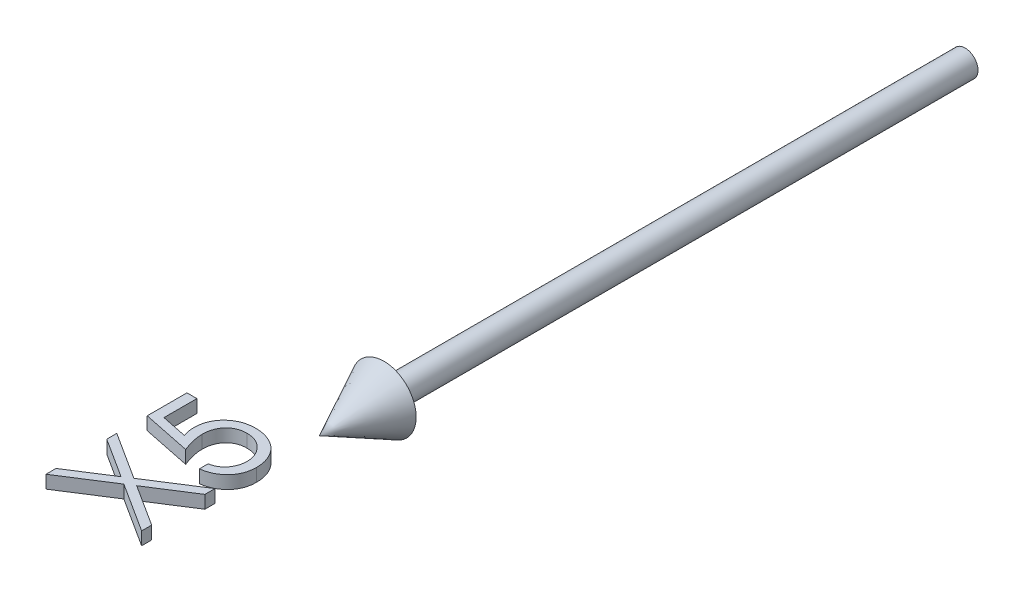
from build123d import *

# Parameters (mm, degrees)
BOSS_EXTRUDE1_DEPTH        = 1
BOSS_EXTRUDE1_DEPTH_BACK   = 1
BOSS_EXTRUDE1_2_DEPTH      = 1
BOSS_EXTRUDE1_2_DEPTH_BACK = 1


with BuildPart() as part:
    # Sketch2 → Revolve1 (revolve)
    with BuildSketch(Plane(origin=(0, 0, 0), x_dir=(1, 0, 0), z_dir=(0, 1, 0))):
        Polygon((0, -100), (5, -90), (2, -90), (2, 0), (0, 0), align=None)
    revolve(axis=Axis((0, 0, -41.949952025), (0, 0, 1)))


with BuildPart() as body_2:
    # Sketch3 → Boss-Extrude1 (new, two sides: drawn at the far end of the back side and taken through both)
    with BuildSketch(Plane(origin=(0, 0, 0), x_dir=(1, 0, 0), z_dir=(0, 1, 0)).offset(-BOSS_EXTRUDE1_DEPTH_BACK)):
        with BuildLine():
            Line((-15, -105.491265497), (-13.461538462, -105.491265497))
            Line((-13.461538462, -105.491265497), (-13.461538462, -110.593428959))
            Line((-13.461538462, -110.593428959), (-9.516225962, -111.401722228))
            add(Edge.make_bspline(
                [(-9.516225962, -111.401722228), (-9.560069984, -111.242911338), (-9.645010842, -110.935240355), (-9.739321287, -110.481126666), (-9.79617319, -110.050017222), (-9.803935949, -109.770265635), (-9.807692308, -109.634895305)],
                knots=[0, 0, 0, 0, 1.100273476, 2.13160584, 3.095893838, 4, 4, 4, 4], degree=3))
            add(Edge.make_bspline(
                [(-9.807692308, -109.634895305), (-9.804186599, -109.467362816), (-9.797293501, -109.137952086), (-9.727174227, -108.656733635), (-9.625612174, -108.195045052), (-9.469136601, -107.759703129), (-9.278052021, -107.343820317), (-9.037376819, -106.954538899), (-8.756389114, -106.586395295), (-8.436536051, -106.241933926), (-8.080861965, -105.930906791), (-7.696859719, -105.660634461), (-7.292908883, -105.424736854), (-6.859541679, -105.24075789), (-6.40493156, -105.090613109), (-5.923830784, -104.991607265), (-5.420510455, -104.925475651), (-5.076344015, -104.918102335), (-4.900841346, -104.91434242)],
                knots=[0, 0, 0, 0, 1.052805225, 2.070078116, 3.052532748, 4.020689046, 4.973125432, 5.925915817, 6.89216474, 7.881560752, 8.877013184, 9.857446635, 10.830895175, 11.812622661, 12.812548702, 13.836681939, 14.896847428, 16, 16, 16, 16], degree=3))
            add(Edge.make_bspline(
                [(-4.900841346, -104.91434242), (-4.778604023, -104.91719531), (-4.535781307, -104.922862536), (-4.175152107, -104.951618839), (-3.822210194, -105.007197663), (-3.477602628, -105.080912452), (-3.141006659, -105.179318054), (-2.810537702, -105.29442129), (-2.489814366, -105.437486998), (-2.177420147, -105.596091315), (-1.876930293, -105.771715704), (-1.595549591, -105.969201429), (-1.326856873, -106.174400474), (-1.078831903, -106.398618314), (-0.850512632, -106.639305714), (-0.640770308, -106.895123466), (-0.445840686, -107.163751263), (-0.273693897, -107.449419965), (-0.115280519, -107.745743978), (0.014677308, -108.057008012), (0.130865337, -108.376125233), (0.223477584, -108.707689004), (0.296045678, -109.050948195), (0.345333966, -109.406468663), (0.381232984, -109.77238582), (0.383480228, -110.020421588), (0.384615385, -110.145712612)],
                knots=[0, 0, 0, 0, 1.056393913, 2.098511576, 3.122979385, 4.141471433, 5.141222888, 6.151259816, 7.162667642, 8.172852865, 9.177685681, 10.166741883, 11.141342384, 12.097242845, 13.052202613, 14.005160326, 14.953864445, 15.917140761, 16.884916217, 17.854238259, 18.828761908, 19.81781811, 20.826036654, 21.857789401, 22.917898972, 24, 24, 24, 24], degree=3))
            add(Edge.make_bspline(
                [(0.384615385, -110.145712612), (0.381646688, -110.295169576), (0.375806128, -110.589208495), (0.314983266, -111.020065252), (0.227294847, -111.434358028), (0.097379703, -111.830311224), (-0.072734928, -112.206273489), (-0.274856842, -112.567628516), (-0.515479886, -112.909897473), (-0.792403166, -113.230740364), (-1.096683506, -113.525666103), (-1.423725263, -113.793106936), (-1.773944943, -114.02823681), (-2.146203734, -114.231908647), (-2.539841347, -114.405418488), (-2.956070668, -114.541783086), (-3.392788289, -114.651829165), (-3.693445734, -114.698387234), (-3.846153846, -114.722034728)],
                knots=[0, 0, 0, 0, 1.046872515, 2.059598001, 3.044168548, 4.012104806, 4.973680974, 5.932408326, 6.910122221, 7.900780896, 8.89867654, 9.876692837, 10.858029398, 11.85084981, 12.847361615, 13.868568023, 14.917415949, 16, 16, 16, 16], degree=3))
            Line((-3.846153846, -114.722034728), (-3.846153846, -113.375880882))
            add(Edge.make_bspline(
                [(-3.846153846, -113.375880882), (-3.703097014, -113.342779214), (-3.428133839, -113.279155972), (-3.042054853, -113.139141294), (-2.697889799, -112.96961144), (-2.393534398, -112.763323139), (-2.123417488, -112.524208587), (-1.885256014, -112.246250277), (-1.670131171, -111.936397076), (-1.490506155, -111.591901168), (-1.339196302, -111.227752327), (-1.231216621, -110.848796192), (-1.165854198, -110.460486677), (-1.1578639, -110.199046879), (-1.153846154, -110.067587612)],
                knots=[0, 0, 0, 0, 1.13623081, 2.183898708, 3.172478118, 4.09966615, 5.022692284, 5.957376522, 6.927682873, 7.937366477, 8.960015386, 9.976409503, 10.982481913, 12, 12, 12, 12], degree=3))
            add(Edge.make_bspline(
                [(-1.153846154, -110.067587612), (-1.157393206, -109.939205171), (-1.16437738, -109.686419093), (-1.217265273, -109.314214069), (-1.300858252, -108.955914409), (-1.417967227, -108.610884082), (-1.572895535, -108.280818503), (-1.763216032, -107.966184348), (-1.984180393, -107.662499377), (-2.236734594, -107.377756122), (-2.51520754, -107.117029371), (-2.812959591, -106.886642402), (-3.130605369, -106.694742286), (-3.462632597, -106.533024427), (-3.81268371, -106.410224642), (-4.179117276, -106.322620418), (-4.562838631, -106.271178743), (-4.824564243, -106.264102256), (-4.957932692, -106.260496266)],
                knots=[0, 0, 0, 0, 1.027268864, 2.022700798, 3.002744649, 3.968653148, 4.933396556, 5.915045722, 6.907600446, 7.935526002, 8.956456544, 9.95700807, 10.942805781, 11.92166854, 12.907987664, 13.905483474, 14.932689774, 16, 16, 16, 16], degree=3))
            add(Edge.make_bspline(
                [(-4.957932692, -106.260496266), (-5.078271566, -106.263232575), (-5.312824471, -106.268565925), (-5.657184407, -106.314736372), (-5.983536333, -106.391863377), (-6.293300258, -106.501676562), (-6.585485797, -106.638726929), (-6.859449051, -106.81079782), (-7.117765997, -107.010562304), (-7.35378905, -107.243782814), (-7.571970379, -107.49747845), (-7.757289776, -107.778165413), (-7.914888843, -108.078350404), (-8.044013421, -108.398589709), (-8.146871035, -108.739277792), (-8.217957334, -109.100598148), (-8.260494301, -109.482633124), (-8.266264657, -109.743957314), (-8.269230769, -109.878284728)],
                knots=[0, 0, 0, 0, 1.045723156, 2.038222538, 3.013889863, 3.95567481, 4.890389958, 5.81331128, 6.76251276, 7.723027653, 8.692928204, 9.666105983, 10.639751036, 11.635719707, 12.66315958, 13.728667616, 14.832476222, 16, 16, 16, 16], degree=3))
            add(Edge.make_bspline(
                [(-8.269230769, -109.878284728), (-8.266742521, -109.994551565), (-8.261604921, -110.234613088), (-8.223777077, -110.602853774), (-8.16275153, -110.989818301), (-8.078810469, -111.394023282), (-7.968962997, -111.816682603), (-7.837329423, -112.25690432), (-7.679949429, -112.715614034), (-7.561097084, -113.024689996), (-7.5, -113.183573189)],
                knots=[0, 0, 0, 0, 0.817624296, 1.688186739, 2.600797293, 3.572016777, 4.590301741, 5.671205678, 6.80286297, 8, 8, 8, 8], degree=3))
            Line((-7.5, -113.183573189), (-15, -111.645111651))
            Line((-15, -111.645111651), (-15, -105.491265497))
        make_face()
    extrude(amount=BOSS_EXTRUDE1_DEPTH + BOSS_EXTRUDE1_DEPTH_BACK)


with BuildPart() as body_3:
    # Sketch3 → Boss-Extrude1 2 (new, two sides: drawn at the far end of the back side and taken through both)
    with BuildSketch(Plane(origin=(0, 0, 0), x_dir=(1, 0, 0), z_dir=(0, 1, 0)).offset(-BOSS_EXTRUDE1_2_DEPTH_BACK)):
        Polygon((-15, -127.318188574), (-15, -125.764702997), (-8.864182692, -121.837419343), (-15, -117.910135689), (-15, -116.356650112), (-7.650240385, -121.059174151), (0, -116.16434242), (0, -117.717827997), (-6.436298077, -121.837419343), (0, -125.957010689), (0, -127.510496266), (-7.650240385, -122.612659728), align=None)
    extrude(amount=BOSS_EXTRUDE1_2_DEPTH + BOSS_EXTRUDE1_2_DEPTH_BACK)


solid = Compound([part.part, body_2.part, body_3.part])
